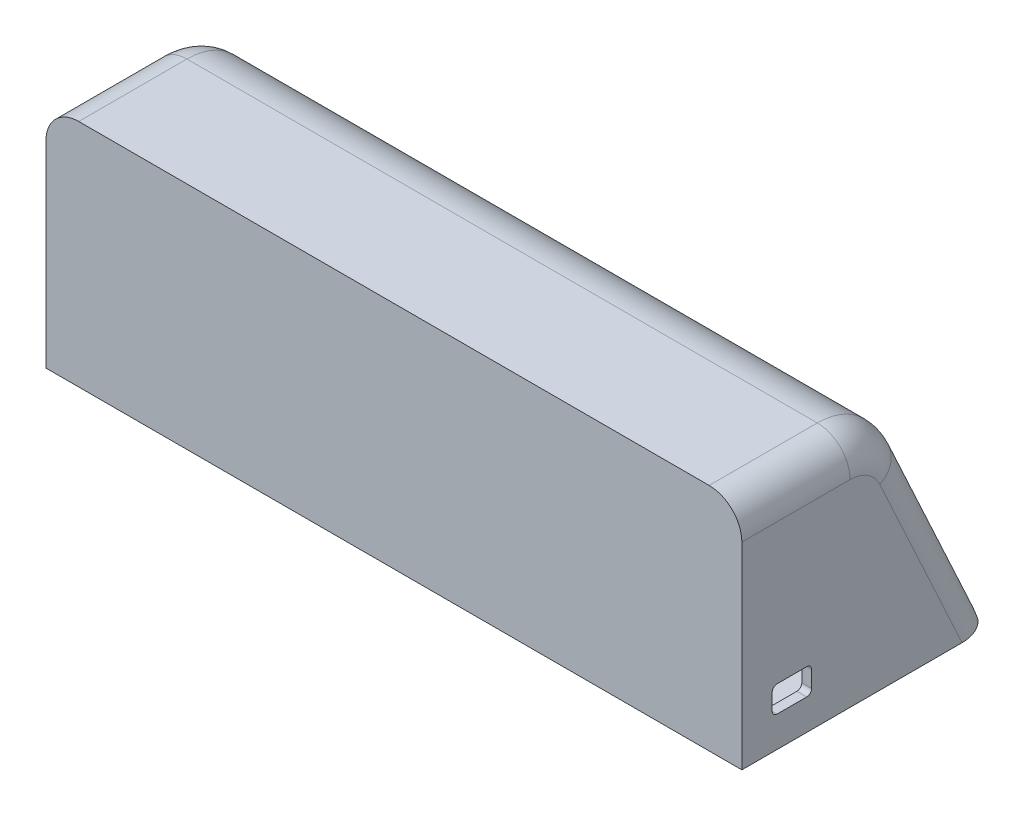
from build123d import *

# Parameters (mm, degrees)
BOSS_EXTRUDE1_DEPTH      = 65
BOSS_EXTRUDE1_DEPTH_BACK = 5.257976811
SKETCH1_W                = 212.572493444
SKETCH1_H                = 75.846939693
CHAMFER3_START           = 49.937766148
CHAMFER3_OUTLINE_W       = 212.572493444
CHAMFER3_OUTLINE_H       = 79
CHAMFER3_DEPTH           = 28.062233852
SHELL2_T                 = 3
CUT_EXTRUDE1_REACH       = 205.789
SKETCH10_R               = 22.75
SKETCH10_3_R             = 2.25
BOSS_EXTRUDE2_DEPTH      = 11
FILLET1_R                = 2
MOVE_START               = 45.121847379
MOVE_FACE4_OUTLINE_W     = 206.572493444
MOVE_FACE4_OUTLINE_H     = 74
MOVE_FACE4_OUTLINE_R     = 2.25
MOVE_FACE4_OUTLINE_R_2   = 22.75
MOVE_FACE4_DEPTH         = 1.815918769
FILLET2_R                = 20
FILLET3_R                = 10
FILLET4_R                = 10
CUT_EXTRUDE2_REACH       = 230.991
SKETCH11_W               = 12.043775689
SKETCH11_H               = 8.004704573
FILLET5_R                = 1.5
FILLET6_R                = 15


with BuildPart() as part:
    # Sketch1 → Boss-Extrude1 (new, two sides: drawn at the far end of the back side and taken through both)
    with BuildSketch(Plane(origin=(0, 0, 0), x_dir=(1, 0, 0), z_dir=(0, 1, 0)).offset(-BOSS_EXTRUDE1_DEPTH_BACK)):
        with Locations((81.347467195, 17.076530153)):
            Rectangle(SKETCH1_W, SKETCH1_H)
    extrude(amount=BOSS_EXTRUDE1_DEPTH + BOSS_EXTRUDE1_DEPTH_BACK)

    # Chamfer3: read off the stored shape, not the designer's step
    # Chamfer3 outline → Chamfer3 (cut)
    with BuildSketch(Plane(origin=(0, 0, 0), x_dir=(1, 0, 0), z_dir=(0, 0.4190581774617469, -0.9079593845004518)).offset(CHAMFER3_START)):
        with Locations((81.347467195, -10.5)):
            Rectangle(CHAMFER3_OUTLINE_W, CHAMFER3_OUTLINE_H)
    extrude(amount=CHAMFER3_DEPTH, mode=Mode.SUBTRACT)

    # Shell2 (no face opened: a closed hollow body)
    add(offset(amount=-SHELL2_T, mode=Mode.PRIVATE), mode=Mode.SUBTRACT)

    # Sketch10 → Cut-Extrude1 (cut, up to next)
    with BuildSketch(Plane(origin=(0, 20.926829268, -45.341463415), x_dir=(-1, 0, 0), z_dir=(0, 0.41905817746174684, -0.9079593845004517)), mode=Mode.PRIVATE) as cut_extrude1_sk1:
        with Locations(Location((-153.880265717, 16.51594475, 0), (0, 0, 90))):
            Circle(SKETCH10_R)
    cut_extrude1_tool1 = extrude(cut_extrude1_sk1.sketch, amount=-CUT_EXTRUDE1_REACH, mode=Mode.PRIVATE) & part.part
    # Sketch10 → Cut-Extrude1 (cut, up to next)
    with BuildSketch(Plane(origin=(0, 20.926829268, -45.341463415), x_dir=(-1, 0, 0), z_dir=(0, 0.41905817746174684, -0.9079593845004517)), mode=Mode.PRIVATE) as cut_extrude1_sk2:
        with Locations(Location((-105.380265717, 16.51594475, 0), (0, 0, 90))):
            Circle(SKETCH10_R)
    cut_extrude1_tool2 = extrude(cut_extrude1_sk2.sketch, amount=-CUT_EXTRUDE1_REACH, mode=Mode.PRIVATE) & part.part
    # Sketch10 → Cut-Extrude1 (cut, up to next)
    with BuildSketch(Plane(origin=(0, 20.926829268, -45.341463415), x_dir=(-1, 0, 0), z_dir=(0, 0.41905817746174684, -0.9079593845004517)), mode=Mode.PRIVATE) as cut_extrude1_sk3:
        with Locations(Location((-56.880265717, 16.51594475, 0), (0, 0, 90))):
            Circle(SKETCH10_R)
    cut_extrude1_tool3 = extrude(cut_extrude1_sk3.sketch, amount=-CUT_EXTRUDE1_REACH, mode=Mode.PRIVATE) & part.part
    # Sketch10 → Cut-Extrude1 (cut, up to next)
    with BuildSketch(Plane(origin=(0, 20.926829268, -45.341463415), x_dir=(-1, 0, 0), z_dir=(0, 0.41905817746174684, -0.9079593845004517)), mode=Mode.PRIVATE) as cut_extrude1_sk4:
        with Locations(Location((-8.380265717, 16.51594475, 0), (0, 0, 90))):
            Circle(SKETCH10_R)
    cut_extrude1_tool4 = extrude(cut_extrude1_sk4.sketch, amount=-CUT_EXTRUDE1_REACH, mode=Mode.PRIVATE) & part.part
    add(cut_extrude1_tool1.solids().sort_by_distance((153.880266, 35.922636, -38.420322))[0], mode=Mode.SUBTRACT)
    add(cut_extrude1_tool2.solids().sort_by_distance((105.380266, 35.922636, -38.420322))[0], mode=Mode.SUBTRACT)
    add(cut_extrude1_tool3.solids().sort_by_distance((56.880266, 35.922636, -38.420322))[0], mode=Mode.SUBTRACT)
    add(cut_extrude1_tool4.solids().sort_by_distance((8.380266, 35.922636, -38.420322))[0], mode=Mode.SUBTRACT)

    # Sketch10<3> → Boss-Extrude2 (add)
    with BuildSketch(Plane(origin=(0, 20.926829268, -45.341463415), x_dir=(-1, 0, 0), z_dir=(0, 0.41905817746174684, -0.9079593845004517))):
        with Locations(Location((-135.380265717, 35.01594475, 0), (0, 0, 90))):
            Circle(SKETCH10_3_R)
        with Locations(Location((-135.380265717, -1.98405525, 0), (0, 0, 90))):
            Circle(SKETCH10_3_R)
        with Locations(Location((-172.380265717, 35.01594475, 0), (0, 0, 90))):
            Circle(SKETCH10_3_R)
        with Locations(Location((-172.380265717, -1.98405525, 0), (0, 0, 90))):
            Circle(SKETCH10_3_R)
        with Locations(Location((-86.880265717, -1.98405525, 0), (0, 0, 90))):
            Circle(SKETCH10_3_R)
        with Locations(Location((-86.880265717, 35.01594475, 0), (0, 0, 90))):
            Circle(SKETCH10_3_R)
        with Locations(Location((-123.880265717, 35.01594475, 0), (0, 0, 90))):
            Circle(SKETCH10_3_R)
        with Locations(Location((-123.880265717, -1.98405525, 0), (0, 0, 90))):
            Circle(SKETCH10_3_R)
        with Locations(Location((-38.380265717, -1.98405525, 0), (0, 0, 90))):
            Circle(SKETCH10_3_R)
        with Locations(Location((-38.380265717, 35.01594475, 0), (0, 0, 90))):
            Circle(SKETCH10_3_R)
        with Locations(Location((-75.380265717, 35.01594475, 0), (0, 0, 90))):
            Circle(SKETCH10_3_R)
        with Locations(Location((-75.380265717, -1.98405525, 0), (0, 0, 90))):
            Circle(SKETCH10_3_R)
        with Locations(Location((10.119734283, -1.98405525, 0), (0, 0, 90))):
            Circle(SKETCH10_3_R)
        with Locations(Location((10.119734283, 35.01594475, 0), (0, 0, 90))):
            Circle(SKETCH10_3_R)
        with Locations(Location((-26.880265717, 35.01594475, 0), (0, 0, 90))):
            Circle(SKETCH10_3_R)
        with Locations(Location((-26.880265717, -1.98405525, 0), (0, 0, 90))):
            Circle(SKETCH10_3_R)
    extrude(amount=-BOSS_EXTRUDE2_DEPTH)

    # Fillet1
    fillet1_edges = [part.edges().sort_by_distance(p)[0] for p in [
        (26.880265717, 46.067336344, -21.623073095),
        (-10.119734283, 46.067336344, -21.623073095),
        (-10.119734283, 12.472839117, -37.128225662),
        (86.880265717, 46.067336344, -21.623073095),
        (26.880265717, 12.472839117, -37.128225662),
        (123.880265717, 46.067336344, -21.623073095),
        (172.380265717, 46.067336344, -21.623073095),
        (135.380265717, 46.067336344, -21.623073095),
        (172.380265717, 12.472839117, -37.128225662),
        (135.380265717, 12.472839117, -37.128225662),
        (123.880265717, 12.472839117, -37.128225662),
        (86.880265717, 12.472839117, -37.128225662),
        (75.380265717, 12.472839117, -37.128225662),
        (38.380265717, 12.472839117, -37.128225662),
        (38.380265717, 46.067336344, -21.623073095),
        (75.380265717, 46.067336344, -21.623073095),
    ]]
    fillet(fillet1_edges, radius=FILLET1_R)

    # Move Face4: read off the stored shape, not the designer's step
    # Move Face4 outline → Move Face4 (add)
    with BuildSketch(Plane(origin=(0, 0, 0), x_dir=(1, 0, 0), z_dir=(0, 0.4190581774617469, -0.9079593845004518)).offset(MOVE_START)):
        with Locations((81.347467195, -12)):
            Rectangle(MOVE_FACE4_OUTLINE_W, MOVE_FACE4_OUTLINE_H)
        with Locations((-10.119734283, -35.01594475)):
            Circle(MOVE_FACE4_OUTLINE_R, mode=Mode.SUBTRACT)
        with Locations((26.880265717, -35.01594475)):
            Circle(MOVE_FACE4_OUTLINE_R, mode=Mode.SUBTRACT)
        with Locations((38.380265717, -35.01594475)):
            Circle(MOVE_FACE4_OUTLINE_R, mode=Mode.SUBTRACT)
        with Locations((75.380265717, -35.01594475)):
            Circle(MOVE_FACE4_OUTLINE_R, mode=Mode.SUBTRACT)
        with Locations((8.380265717, -16.51594475)):
            Circle(MOVE_FACE4_OUTLINE_R_2, mode=Mode.SUBTRACT)
        with Locations((56.880265717, -16.51594475)):
            Circle(MOVE_FACE4_OUTLINE_R_2, mode=Mode.SUBTRACT)
        with Locations((86.880265717, -35.01594475)):
            Circle(MOVE_FACE4_OUTLINE_R, mode=Mode.SUBTRACT)
        with Locations((123.880265717, -35.01594475)):
            Circle(MOVE_FACE4_OUTLINE_R, mode=Mode.SUBTRACT)
        with Locations((135.380265717, -35.01594475)):
            Circle(MOVE_FACE4_OUTLINE_R, mode=Mode.SUBTRACT)
        with Locations((172.380265717, -35.01594475)):
            Circle(MOVE_FACE4_OUTLINE_R, mode=Mode.SUBTRACT)
        with Locations((105.380265717, -16.51594475)):
            Circle(MOVE_FACE4_OUTLINE_R_2, mode=Mode.SUBTRACT)
        with Locations((153.880265717, -16.51594475)):
            Circle(MOVE_FACE4_OUTLINE_R_2, mode=Mode.SUBTRACT)
        with Locations((-10.119734283, 1.98405525)):
            Circle(MOVE_FACE4_OUTLINE_R, mode=Mode.SUBTRACT)
        with Locations((26.880265717, 1.98405525)):
            Circle(MOVE_FACE4_OUTLINE_R, mode=Mode.SUBTRACT)
        with Locations((38.380265717, 1.98405525)):
            Circle(MOVE_FACE4_OUTLINE_R, mode=Mode.SUBTRACT)
        with Locations((75.380265717, 1.98405525)):
            Circle(MOVE_FACE4_OUTLINE_R, mode=Mode.SUBTRACT)
        with Locations((86.880265717, 1.98405525)):
            Circle(MOVE_FACE4_OUTLINE_R, mode=Mode.SUBTRACT)
        with Locations((123.880265717, 1.98405525)):
            Circle(MOVE_FACE4_OUTLINE_R, mode=Mode.SUBTRACT)
        with Locations((135.380265717, 1.98405525)):
            Circle(MOVE_FACE4_OUTLINE_R, mode=Mode.SUBTRACT)
        with Locations((172.380265717, 1.98405525)):
            Circle(MOVE_FACE4_OUTLINE_R, mode=Mode.SUBTRACT)
    extrude(amount=MOVE_FACE4_DEPTH)

    # Fillet2
    # the kernel refuses this fillet: 20 mm, written as the material it takes off along each edge
    with BuildSketch(Plane(origin=(-56.930399001, 65, -25.000000001), x_dir=(0, -0.9079593845004517, -0.41905817746174706), z_dir=(1, 0, 0))) as fillet2_piece_1:
        with BuildLine():
            CenterArc((FILLET2_R * 0.639832389483, -FILLET2_R), FILLET2_R, 90, 65.224859431)
            Line((-FILLET2_R * 0.268126995018, -FILLET2_R * 0.580941822538), (0, 0))
            Line((0, 0), (FILLET2_R * 0.639832389483, 0))
        make_face()
    extrude(amount=276.555732392, mode=Mode.SUBTRACT)

    # Fillet3
    fillet3_edges = [part.edges().sort_by_distance(p)[0] for p in [
        (-24.938779527, 65, 4.321793741),
        (-24.938779527, 26.690581775, -42.68126995),
        (-24.938779527, 61.846709931, -22.982422881),
    ]]
    fillet(fillet3_edges, radius=FILLET3_R)

    # Fillet4
    fillet4_edges = [part.edges().sort_by_distance(p)[0] for p in [
        (187.633713917, 65, 4.321793741),
        (187.633713917, 61.846709931, -22.982422881),
        (187.633713917, 26.690581775, -42.68126995),
    ]]
    fillet(fillet4_edges, radius=FILLET4_R)

    # Sketch11 → Cut-Extrude2 (cut, up to next)
    with BuildSketch(Plane(origin=(187.633713917, 0, 0), x_dir=(0, 0, -1), z_dir=(1, 0, 0)), mode=Mode.PRIVATE) as cut_extrude2_sk1:
        with Locations((-5.560068145, 8.129919943)):
            Rectangle(SKETCH11_W, SKETCH11_H)
    cut_extrude2_tool1 = extrude(cut_extrude2_sk1.sketch, amount=-CUT_EXTRUDE2_REACH, mode=Mode.PRIVATE) & part.part
    add(cut_extrude2_tool1.solids().sort_by_distance((187.633714, 8.12992, 5.560068))[0], mode=Mode.SUBTRACT)

    # Fillet5
    fillet5_edges = [part.edges().sort_by_distance(p)[0] for p in [
        (186.133713917, 4.127567657, 11.581955989),
        (186.133713917, 12.13227223, 11.581955989),
        (186.133713917, 12.13227223, -0.4618197),
        (186.133713917, 4.127567657, -0.4618197),
    ]]
    fillet(fillet5_edges, radius=FILLET5_R)

    # Fillet6
    fillet6_edges = [part.edges().sort_by_distance(p)[0] for p in [
        (81.347467195, 62, -21.080502832),
    ]]
    fillet(fillet6_edges, radius=FILLET6_R)


solid = part.part
